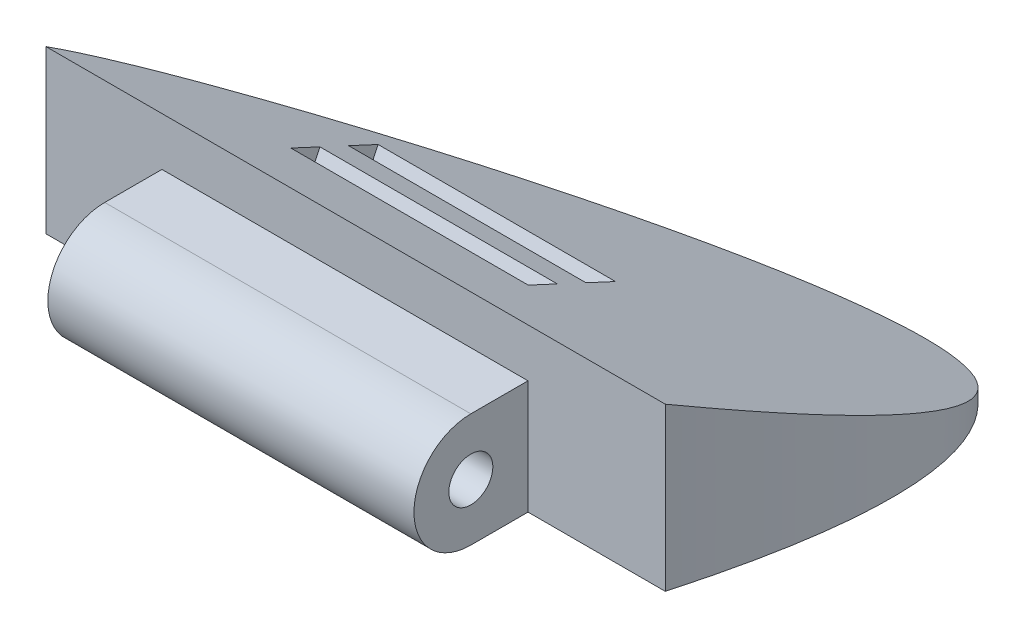
from build123d import *

# Parameters (mm, degrees)
BOSS_EXTRUDE1_DEPTH     = 12.7
SKETCH2_W               = 19.216952518
SKETCH2_H               = 6.005297662
CUT_EXTRUDE1_DEPTH      = 2.54
CUT_EXTRUDE2_DEPTH      = 11.684
CUT_EXTRUDE2_DEPTH_BACK = 26.924
SKETCH3_R               = 1.155216028
SKETCH4_W               = 12.461072243
SKETCH4_H               = 1.682353049
SKETCH4_H_2             = 1.706386664
CUT_EXTRUDE4_DEPTH      = 3.81
SKETCH5_W               = 12.461072243
SKETCH5_H               = 1.883415491
CUT_EXTRUDE5_DEPTH      = 2.54
CUT_EXTRUDE6_DEPTH      = 39.140046002
CUT_EXTRUDE6_DEPTH_BACK = 3.81
SKETCH6_W               = 12.87502722
SKETCH6_H               = 1.686706137
SKETCH6_H_2             = 1.657293844


with BuildPart() as part:
    # Sketch1 → Boss-Extrude1 (new body)
    with BuildSketch(Plane(origin=(0, 0, 0), x_dir=(1, 0, 0), z_dir=(0, 1, 0))):
        with BuildLine():
            Line((0, 0), (19.216952518, 0))
            Line((19.216952518, 0), (19.216952518, 6.005297662))
            Line((19.216952518, 6.005297662), (26.423309712, 6.005297662))
            add(Edge.make_bspline(
                [(26.423309712, 6.005297662), (36.55952446, 42.663140535), (-2.021004002, 14.397041287), (-6.085368297, 6.005297662)],
                knots=[0, 0, 0, 0, 1, 1, 1, 1], degree=3))
            Line((-6.085368297, 6.005297662), (0, 6.005297662))
            Line((0, 6.005297662), (0, 0))
        make_face()
    extrude(amount=BOSS_EXTRUDE1_DEPTH)

    # Sketch2 → Cut-Extrude1 (cut)
    with BuildSketch(Plane(origin=(0, 12.7, 0), x_dir=(1, 0, 0), z_dir=(0, 1, 0))):
        with Locations((9.608476259, 3.002648831)):
            Rectangle(SKETCH2_W, SKETCH2_H)
    extrude(amount=-CUT_EXTRUDE1_DEPTH, mode=Mode.SUBTRACT)

    # Sketch3 → Cut-Extrude2 (cut, two sides: drawn at the far end of the back side and taken through both)
    with BuildSketch(Plane(origin=(19.216952518, 0, 0), x_dir=(0, 0, -1), z_dir=(1, 0, 0)).offset(-CUT_EXTRUDE2_DEPTH_BACK)):
        with BuildLine():
            Line((3.002648831, 10.16), (0, 10.16))
            Line((0, 10.16), (0, 0))
            Line((0, 0), (24.327643381, 0))
            Line((24.327643381, 0), (24.327643381, 4.189551825))
            Line((24.327643381, 4.189551825), (3.002648831, 4.189551825))
            ThreePointArc((3.002648831, 4.189551825), (0.017424743, 7.174775912), (3.002648831, 10.16))
        make_face()
        Polygon((24.327643381, 12.7), (6.005297662, 12.7), (24.327643381, 4.189551825), align=None)
        with Locations((3.002648831, 7.174775912)):
            Circle(SKETCH3_R)
    extrude(amount=CUT_EXTRUDE2_DEPTH + CUT_EXTRUDE2_DEPTH_BACK, mode=Mode.SUBTRACT)

    # Sketch4 → Cut-Extrude4 (cut)
    with BuildSketch(Plane(origin=(0, 12.740629014, -5.917826495), x_dir=(1, 0, 0), z_dir=(0, 0.906940045904058, -0.42125972171042575))):
        with Locations((9.608476259, 4.676059638)):
            Rectangle(SKETCH4_W, SKETCH4_H)
        with Locations((9.608476259, 8.028748928)):
            Rectangle(SKETCH4_W, SKETCH4_H_2)
    extrude(amount=-CUT_EXTRUDE4_DEPTH, mode=Mode.SUBTRACT)

    # Sketch5 → Cut-Extrude5 (cut)
    with BuildSketch(Plane(origin=(0, -2.32418937, -5.003802419), x_dir=(1, 0, 0), z_dir=(0, 0.4212597217104258, 0.906940045904058))):
        with Locations((9.608476259, 11.179636351)):
            Rectangle(SKETCH5_W, SKETCH5_H)
    extrude(amount=-CUT_EXTRUDE5_DEPTH, mode=Mode.SUBTRACT)

    # Sketch6 → Cut-Extrude6 (cut, two sides: drawn at the far end of the back side and taken through both)
    with BuildSketch(Plane(origin=(0, 4.189551825, 0), x_dir=(-1, 0, 0), z_dir=(0, -1, 0)).offset(-CUT_EXTRUDE6_DEPTH_BACK)):
        with Locations((-9.608476259, 9.230258043)):
            Rectangle(SKETCH6_W, SKETCH6_H)
        with Locations((-9.608476259, 12.681510307)):
            Rectangle(SKETCH6_W, SKETCH6_H_2)
    extrude(amount=CUT_EXTRUDE6_DEPTH + CUT_EXTRUDE6_DEPTH_BACK, mode=Mode.SUBTRACT)


solid = part.part
